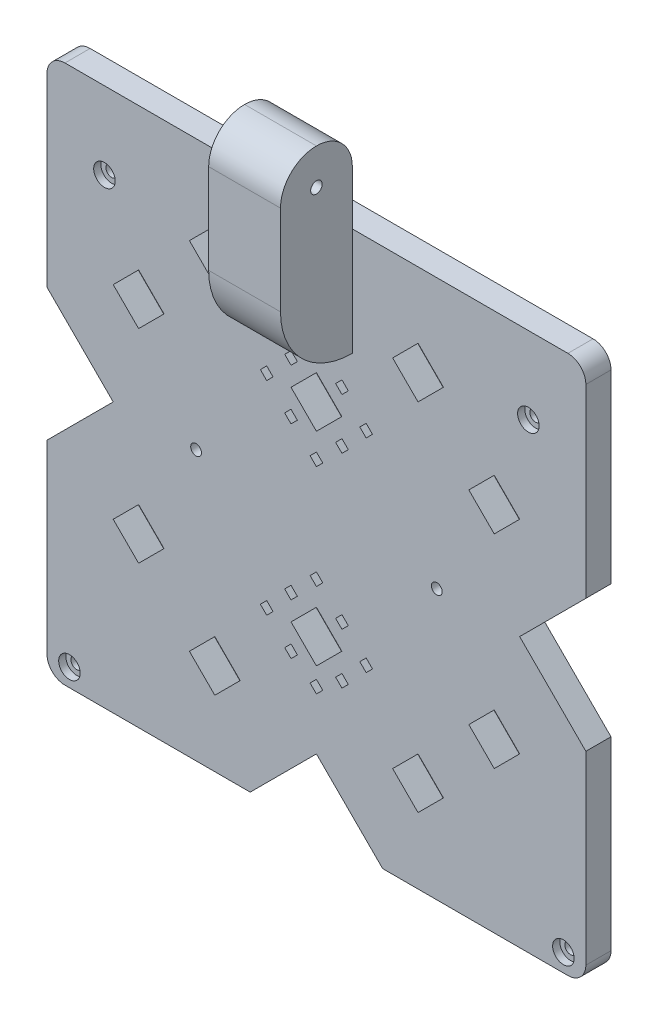
from build123d import *

# Parameters (mm, degrees)
SKETCH_1_W           = 150
SKETCH_1_H           = 150
EXTRUDE_1_DEPTH      = 7
CUT_EXTRUDE_1_DEPTH  = 7
SKETCH_11_R          = 1.5
CUT_EXTRUDE_3_DEPTH  = 7
CUT_EXTRUDE_4_DEPTH  = 0.5
CUT_EXTRUDE_5_DEPTH  = 2
SKETCH_14_R          = 1.6
CUT_EXTRUDE_6_DEPTH  = 3.5
SKETCH_15_R          = 1.6
CUT_EXTRUDE_7_DEPTH  = 7
EXTRUDE_6_DEPTH      = 20
FILLET_5_R           = 20
SKETCH_20_W          = 20
SKETCH_20_H          = 20
EXTRUDE_7_DEPTH      = 25
FILLET_6_R           = 10
SKETCH_21_R          = 1.6
CUT_EXTRUDE_8_DEPTH  = 35
CUT_EXTRUDE_9_DEPTH  = 7
SKETCH_26_R          = 3
CUT_EXTRUDE_10_DEPTH = 2
FILLET_7_R           = 5
CUT_EXTRUDE_11_DEPTH = 2


with BuildPart() as part:
    # 草圖1 → 填料-伸長1 (new body)
    with BuildSketch(Plane.XY):
        Rectangle(SKETCH_1_W, SKETCH_1_H)
    extrude(amount=EXTRUDE_1_DEPTH)

    # 草圖3 → 除料-伸長1 (cut)
    with BuildSketch(Plane.XY.offset(7)):
        Polygon((-75, 18.431457505), (-56.568542495, 0), (-75, -18.431457505), align=None)
        Polygon((18.431457505, -75), (-18.431457505, -75), (0, -56.568542495), align=None)
        Polygon((75, 18.431457505), (75, -18.431457505), (56.568542495, 0), align=None)
    extrude(amount=-CUT_EXTRUDE_1_DEPTH, mode=Mode.SUBTRACT)

    # 草圖11 → 除料-伸長3 (cut)
    with BuildSketch(Plane.XY.offset(7)):
        with Locations((-33.5, 0)):
            Circle(SKETCH_11_R)
        with Locations((33.5, 0)):
            Circle(SKETCH_11_R)
    extrude(amount=-CUT_EXTRUDE_3_DEPTH, mode=Mode.SUBTRACT)

    # 草圖12 → 除料-伸長4 (cut)
    with BuildSketch(Plane(origin=(0, 0, 0), x_dir=(-1, 0, 0), z_dir=(0, 0, -1))):
        Polygon((-65.17, -70), (-66.96, -66.899629054), (-70.54, -66.899629054), (-72.33, -70), (-70.54, -73.100370946), (-66.96, -73.100370946), align=None)
        Polygon((72.33, -70), (70.54, -66.899629054), (66.96, -66.899629054), (65.17, -70), (66.96, -73.100370946), (70.54, -73.100370946), align=None)
    extrude(amount=-CUT_EXTRUDE_4_DEPTH, mode=Mode.SUBTRACT)

    # 草圖13 → 除料-伸長5 (cut)
    with BuildSketch(Plane(origin=(0, 0, 0.5), x_dir=(-1, 0, 0), z_dir=(0, 0, -1))):
        Polygon((-65.52, -70), (-67.135, -67.202737946), (-70.365, -67.202737946), (-71.98, -70), (-70.365, -72.797262054), (-67.135, -72.797262054), align=None)
        Polygon((71.98, -70), (70.365, -67.202737946), (67.135, -67.202737946), (65.52, -70), (67.135, -72.797262054), (70.365, -72.797262054), align=None)
    extrude(amount=-CUT_EXTRUDE_5_DEPTH, mode=Mode.SUBTRACT)

    # 草圖14 → 除料-伸長6 (cut)
    with BuildSketch(Plane(origin=(0, 0, 2.5), x_dir=(-1, 0, 0), z_dir=(0, 0, -1))):
        with Locations((68.75, -70)):
            Circle(SKETCH_14_R)
        with Locations((-68.75, -70)):
            Circle(SKETCH_14_R)
    extrude(amount=-CUT_EXTRUDE_6_DEPTH, mode=Mode.SUBTRACT)

    # 草圖15 → 除料-伸長7 (cut)
    with BuildSketch(Plane(origin=(0, 0, 0), x_dir=(-1, 0, 0), z_dir=(0, 0, -1))):
        with Locations((59, 53.5)):
            Circle(SKETCH_15_R)
        with Locations((-59.003215638, 53.5)):
            Circle(SKETCH_15_R)
    extrude(amount=-CUT_EXTRUDE_7_DEPTH, mode=Mode.SUBTRACT)

    # 草圖18 → 填料-伸長6 (add)
    with BuildSketch(Plane.XY.offset(7)):
        Polygon((10, 75), (0, 75), (-10, 75), (-10, 45), (10, 45), align=None)
    extrude(amount=EXTRUDE_6_DEPTH)

    # 圓角5
    fillet_5_edges = [part.edges().sort_by_distance(p)[0] for p in [
        (0, 45, 27),
    ]]
    fillet(fillet_5_edges, radius=FILLET_5_R - 0.0001)  # a hair under: the kernel refuses the full size

    # 草圖20 → 填料-伸長7 (add)
    with BuildSketch(Plane(origin=(0, 75, 0), x_dir=(1, 0, 0), z_dir=(0, 1, 0))):
        with Locations((0, -17)):
            Rectangle(SKETCH_20_W, SKETCH_20_H)
    extrude(amount=EXTRUDE_7_DEPTH)

    # 圓角6
    fillet_6_edges = [part.edges().sort_by_distance(p)[0] for p in [
        (0, 100, 7),
        (0, 100, 27),
    ]]
    fillet(fillet_6_edges, radius=FILLET_6_R - 0.0001)  # a hair under: the kernel refuses the full size

    # 草圖21 → 除料-伸長8 (cut)
    with BuildSketch(Plane.ZY.offset(10)):
        with Locations(Location((17, 90, 0), (0, 0, 270))):
            Circle(SKETCH_21_R)
    extrude(amount=-CUT_EXTRUDE_8_DEPTH, mode=Mode.SUBTRACT)

    # 草圖25 → 除料-伸長9 (cut)
    with BuildSketch(Plane.XY.offset(7)):
        Polygon((-42.426406871, -28.284271247), (-49.497474683, -21.213203436), (-56.568542495, -28.284271247), (-49.497474683, -35.355339059), align=None)
        Polygon((-21.213203436, -49.497474683), (-28.284271247, -42.426406871), (-35.355339059, -49.497474683), (-28.284271247, -56.568542495), align=None)
        Polygon((-28.284271247, 56.568542495), (-21.213203436, 49.497474683), (-28.284271247, 42.426406871), (-35.355339059, 49.497474683), align=None)
        Polygon((-49.497474683, 35.355339059), (-42.426406871, 28.284271247), (-49.497474683, 21.213203436), (-56.568542495, 28.284271247), align=None)
        Polygon((28.284271247, -56.568542495), (21.213203436, -49.497474683), (28.284271247, -42.426406871), (35.355339059, -49.497474683), align=None)
        Polygon((49.497474683, -35.355339059), (42.426406871, -28.284271247), (49.497474683, -21.213203436), (56.568542495, -28.284271247), align=None)
        Polygon((56.568542495, 28.284271247), (49.497474683, 35.355339059), (42.426406871, 28.284271247), (49.497474683, 21.213203436), align=None)
        Polygon((35.355339059, 49.497474683), (28.284271247, 56.568542495), (21.213203436, 49.497474683), (28.284271247, 42.426406871), align=None)
        Polygon((-7.071067812, 28.284271247), (0, 35.355339059), (7.071067812, 28.284271247), (0, 21.213203436), align=None)
        Polygon((0, -35.355339059), (7.071067812, -28.284271247), (0, -21.213203436), (-7.071067812, -28.284271247), align=None)
        Polygon((-7.077226007, -22.987128583), (-5.309459054, -21.219361631), (-7.077226007, -19.451594678), (-8.84499296, -21.219361631), align=None)
        Polygon((8.875761996, -21.213203436), (7.107995043, -19.445436483), (5.34022809, -21.213203436), (7.107995043, -22.980970389), align=None)
        Polygon((8.875761996, -35.391657025), (7.107995043, -33.623890072), (5.34022809, -35.391657025), (7.107995043, -37.159423978), align=None)
        Polygon((-5.290984469, -35.355339059), (-7.058751422, -33.587572106), (-8.826518375, -35.355339059), (-7.058751422, -37.123106012), align=None)
        Polygon((-7.058751422, 37.123106012), (-5.290984469, 35.355339059), (-7.058751422, 33.587572106), (-8.826518375, 35.355339059), align=None)
        Polygon((7.107995043, 37.159423978), (8.875761996, 35.391657025), (7.107995043, 33.623890072), (5.34022809, 35.391657025), align=None)
        Polygon((7.107995043, 22.980970389), (8.875761996, 21.213203436), (7.107995043, 19.445436483), (5.34022809, 21.213203436), align=None)
        Polygon((-8.84499296, 21.219361631), (-7.077226007, 22.987128583), (-5.309459054, 21.219361631), (-7.077226007, 19.451594678), align=None)
        Polygon((0, 42.123106012), (1.767766953, 40.355339059), (0, 38.587572106), (-1.767766953, 40.355339059), align=None)
        Polygon((-12.071067812, -28.284271247), (-13.838834765, -26.516504294), (-15.606601718, -28.284271247), (-13.838834765, -30.0520382), align=None)
        Polygon((15.606601718, -28.284271247), (13.838834765, -26.516504294), (12.071067812, -28.284271247), (13.838834765, -30.0520382), align=None)
        Polygon((1.767766953, -14.445436483), (0, -12.67766953), (-1.767766953, -14.445436483), (0, -16.213203436), align=None)
        Polygon((1.767766953, -40.355339059), (0, -38.587572106), (-1.767766953, -40.355339059), (0, -42.123106012), align=None)
        Polygon((13.838834765, 30.0520382), (15.606601718, 28.284271247), (13.838834765, 26.516504294), (12.071067812, 28.284271247), align=None)
        Polygon((-13.838834765, 30.0520382), (-12.071067812, 28.284271247), (-13.838834765, 26.516504294), (-15.606601718, 28.284271247), align=None)
        Polygon((0, 16.213203436), (1.767766953, 14.445436483), (0, 12.67766953), (-1.767766953, 14.445436483), align=None)
    extrude(amount=-CUT_EXTRUDE_9_DEPTH, mode=Mode.SUBTRACT)

    # 草圖26 → 除料-伸長10 (cut)
    with BuildSketch(Plane.XY.offset(7)):
        with Locations((-59, 53.5)):
            Circle(SKETCH_26_R)
        with Locations((-68.75, -70)):
            Circle(SKETCH_26_R)
        with Locations(Location((68.75, -70, 0), (0, 0, 180))):
            Circle(SKETCH_26_R)
        with Locations(Location((59, 53.5, 0), (0, 0, 180))):
            Circle(SKETCH_26_R)
    extrude(amount=-CUT_EXTRUDE_10_DEPTH, mode=Mode.SUBTRACT)

    # 圓角7
    fillet_7_edges = [part.edges().sort_by_distance(p)[0] for p in [
        (-75, -75, 3.5),
        (-75, 75, 3.5),
        (75, 75, 3.5),
        (75, -75, 3.5),
    ]]
    fillet(fillet_7_edges, radius=FILLET_7_R)

    # 草圖27 → 除料-伸長11 (cut)
    with BuildSketch(Plane(origin=(0, 0, 0), x_dir=(-1, 0, 0), z_dir=(0, 0, -1))):
        Polygon((-35.232050808, -3), (-31.767949192, -3), (-30.035898385, 0), (-31.767949192, 3), (-35.232050808, 3), (-36.964101615, 0), align=None)
        Polygon((31.767949192, -3), (30.035898385, 0), (31.767949192, 3), (35.232050808, 3), (36.964101615, 0), (35.232050808, -3), align=None)
    extrude(amount=-CUT_EXTRUDE_11_DEPTH, mode=Mode.SUBTRACT)


solid = part.part
